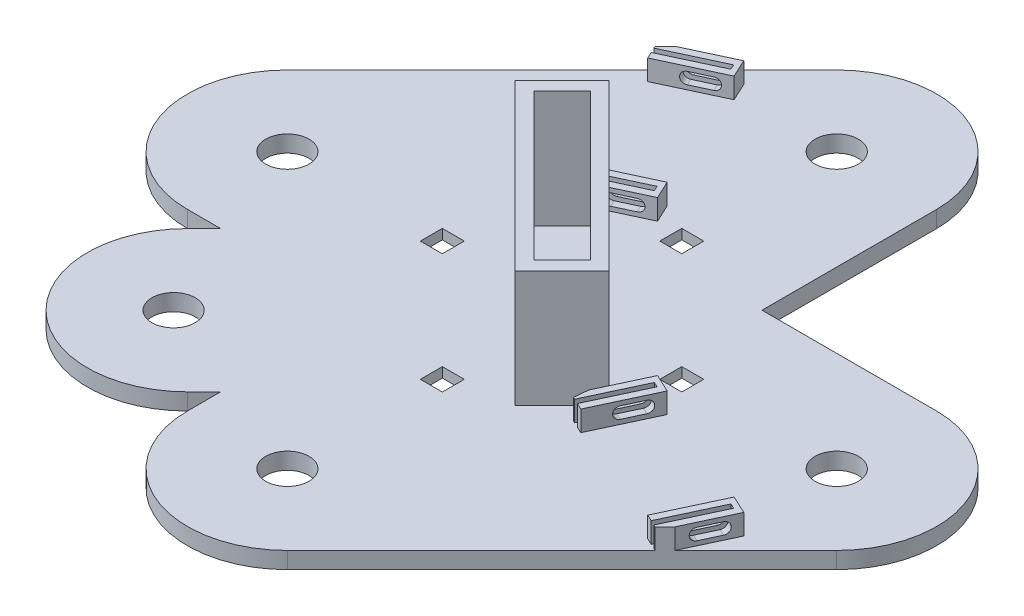
from build123d import *

# Parameters (mm, degrees)
BOSS_EXTRU_1_DEPTH           = 5
ESQUISSE2_R                  = 6.5
ENL_V_MAT_EXTRU_1_DEPTH      = 160.073548788
ENL_V_MAT_EXTRU_2_DEPTH      = 2
ESQUISSE4_R                  = 3.25
ENL_V_MAT_EXTRU_3_DEPTH      = 160.073548788
ESQUISSE5_W                  = 6.6
ESQUISSE5_H                  = 6.6
ENL_V_MAT_EXTRU_4_DEPTH      = 160.073548788
R_P_TITION_CIRCULAIRE1_COUNT = 4
BOSS_EXTRU_2_DEPTH           = 35
ESQUISSE7_R                  = 3.25
ENL_V_MAT_EXTRU_5_DEPTH      = 174.664310989
ENL_V_MAT_EXTRU_6_REACH      = 175.664
ESQUISSE8_W                  = 6.6
ESQUISSE8_H                  = 6.6
ENL_V_MAT_EXTRU_7_DEPTH      = 174.664310989
BOSS_EXTRU_3_DEPTH           = 6.144
ENL_V_MAT_EXTRU_8_REACH      = 251.864


# Read off the part's stored shape, not the designer's step: Symétrie2
with BuildPart() as part:
    # Esquisse1 → Boss.-Extru.1 (new body)
    with BuildSketch(Plane(origin=(0, 0, 0), x_dir=(1, 0, 0), z_dir=(0, 1, 0))):
        with BuildLine():
            Line((-35, -77.426406871), (-30, -72.426406871))
            Line((-30, -72.426406871), (-30, -30))
            Line((-30, -30), (-72.426406871, -30))
            Line((-72.426406871, -30), (-77.426406871, -35))
            ThreePointArc((-77.426406871, -35), (-77.426406871, -77.426406871), (-35, -77.426406871))
        make_face()
        with BuildLine():
            Line((-82.426406871, -30), (-72.426406871, -30))
            Line((-72.426406871, -30), (-30, 12.426406871))
            Line((-30, 12.426406871), (-30, 30))
            Line((-30, 30), (-82.426406871, 30))
            ThreePointArc((-82.426406871, 30), (-93.906909842, 27.716385975), (-103.639610307, 21.213203436))
            ThreePointArc((-103.639610307, 21.213203436), (-110.142792847, -11.480502971), (-82.426406871, -30))
        make_face()
        with BuildLine():
            ThreePointArc((-30, 82.426406871), (-27.716385975, 93.906909842), (-21.213203436, 103.639610307))
            Line((-21.213203436, 103.639610307), (-103.639610307, 21.213203436))
            ThreePointArc((-103.639610307, 21.213203436), (-93.906909842, 27.716385975), (-82.426406871, 30))
            Line((-82.426406871, 30), (-30, 30))
            Line((-30, 30), (-30, 82.426406871))
        make_face()
        with BuildLine():
            ThreePointArc((-1.213203436, 29.975458919), (0, 30), (1.213203436, 29.975458919))
            ThreePointArc((1.213203436, 29.975458919), (1.81968106, 29.993864102), (2.426406871, 30))
            Line((2.426406871, 30), (30, 30))
            Line((30, 30), (30, 82.426406871))
            ThreePointArc((30, 82.426406871), (11.480502971, 110.142792847), (-21.213203436, 103.639610307))
            ThreePointArc((-21.213203436, 103.639610307), (-27.716385975, 93.906909842), (-30, 82.426406871))
            Line((-30, 82.426406871), (-30, 30))
            Line((-30, 30), (-2.426406871, 30))
            ThreePointArc((-2.426406871, 30), (-1.81968106, 29.993864102), (-1.213203436, 29.975458919))
        make_face()
        with BuildLine():
            ThreePointArc((-21.213203436, 21.213203436), (-12.038696424, 27.478533229), (-1.213203436, 29.975458919))
            ThreePointArc((-1.213203436, 29.975458919), (-1.81968106, 29.993864102), (-2.426406871, 30))
            Line((-2.426406871, 30), (-30, 30))
            Line((-30, 30), (-30, 12.426406871))
            Line((-30, 12.426406871), (-21.213203436, 21.213203436))
        make_face()
        with BuildLine():
            ThreePointArc((-29.901714829, 0), (-26.857631607, 10.94025406), (-19.965279452, 19.965279452))
            ThreePointArc((-19.965279452, 19.965279452), (-10.94025406, 26.857631607), (0, 29.901714829))
            ThreePointArc((0, 29.901714829), (-0.606228214, 29.944731584), (-1.213203436, 29.975458919))
            ThreePointArc((-1.213203436, 29.975458919), (-12.038696424, 27.478533229), (-21.213203436, 21.213203436))
            Line((-21.213203436, 21.213203436), (-30, 12.426406871))
            Line((-30, 12.426406871), (-30, 2.426406871))
            ThreePointArc((-30, 2.426406871), (-29.975418636, 1.212208547), (-29.901714829, 0))
        make_face()
        with BuildLine():
            Line((-72.426406871, -30), (-30, -30))
            Line((-30, -30), (-30, -2.426406871))
            ThreePointArc((-30, -2.426406871), (-29.975418636, -1.212208547), (-29.901714829, 0))
            ThreePointArc((-29.901714829, 0), (-29.975418636, 1.212208547), (-30, 2.426406871))
            Line((-30, 2.426406871), (-30, 12.426406871))
            Line((-30, 12.426406871), (-72.426406871, -30))
        make_face()
        with BuildLine():
            ThreePointArc((-2.426406871, -30), (-1.212208547, -29.975418636), (0, -29.901714829))
            ThreePointArc((0, -29.901714829), (-10.94025406, -26.857631607), (-19.965279452, -19.965279452))
            ThreePointArc((-19.965279452, -19.965279452), (-26.857631607, -10.94025406), (-29.901714829, 0))
            ThreePointArc((-29.901714829, 0), (-29.975418636, -1.212208547), (-30, -2.426406871))
            Line((-30, -2.426406871), (-30, -30))
            Line((-30, -30), (-2.426406871, -30))
        make_face()
        with BuildLine():
            Line((-30, -72.426406871), (12.426406871, -30))
            Line((12.426406871, -30), (2.426406871, -30))
            ThreePointArc((2.426406871, -30), (1.212208547, -29.975418636), (0, -29.901714829))
            ThreePointArc((0, -29.901714829), (-1.212208547, -29.975418636), (-2.426406871, -30))
            Line((-2.426406871, -30), (-30, -30))
            Line((-30, -30), (-30, -72.426406871))
        make_face()
        with BuildLine():
            ThreePointArc((21.213203436, -21.213203436), (27.478533229, -12.038696424), (29.975458919, -1.213203436))
            ThreePointArc((29.975458919, -1.213203436), (29.944731584, -0.606228214), (29.901714829, 0))
            ThreePointArc((29.901714829, 0), (26.857631607, -10.94025406), (19.965279452, -19.965279452))
            ThreePointArc((19.965279452, -19.965279452), (10.94025406, -26.857631607), (0, -29.901714829))
            ThreePointArc((0, -29.901714829), (1.212208547, -29.975418636), (2.426406871, -30))
            Line((2.426406871, -30), (12.426406871, -30))
            Line((12.426406871, -30), (21.213203436, -21.213203436))
        make_face()
        with BuildLine():
            Line((30, -30), (30, -2.426406871))
            ThreePointArc((30, -2.426406871), (29.993864102, -1.81968106), (29.975458919, -1.213203436))
            ThreePointArc((29.975458919, -1.213203436), (27.478533229, -12.038696424), (21.213203436, -21.213203436))
            Line((21.213203436, -21.213203436), (12.426406871, -30))
            Line((12.426406871, -30), (30, -30))
        make_face()
        with BuildLine():
            ThreePointArc((1.213203436, 29.975458919), (21.213203436, 21.213203436), (29.975458919, 1.213203436))
            ThreePointArc((29.975458919, 1.213203436), (29.993864102, 1.81968106), (30, 2.426406871))
            Line((30, 2.426406871), (30, 30))
            Line((30, 30), (2.426406871, 30))
            ThreePointArc((2.426406871, 30), (1.81968106, 29.993864102), (1.213203436, 29.975458919))
        make_face()
        with BuildLine():
            ThreePointArc((-19.965279452, 19.965279452), (0, 27.573593129), (19.965279452, 19.965279452))
            ThreePointArc((19.965279452, 19.965279452), (10.94025406, 26.857631607), (0, 29.901714829))
            ThreePointArc((0, 29.901714829), (-10.94025406, 26.857631607), (-19.965279452, 19.965279452))
        make_face()
        with BuildLine():
            ThreePointArc((-19.965279452, -19.965279452), (-27.573593129, 0), (-19.965279452, 19.965279452))
            ThreePointArc((-19.965279452, 19.965279452), (-26.857631607, 10.94025406), (-29.901714829, 0))
            ThreePointArc((-29.901714829, 0), (-26.857631607, -10.94025406), (-19.965279452, -19.965279452))
        make_face()
        with BuildLine():
            ThreePointArc((0, -29.901714829), (10.94025406, -26.857631607), (19.965279452, -19.965279452))
            ThreePointArc((19.965279452, -19.965279452), (0, -27.573593129), (-19.965279452, -19.965279452))
            ThreePointArc((-19.965279452, -19.965279452), (-10.94025406, -26.857631607), (0, -29.901714829))
        make_face()
        with BuildLine():
            Line((30, -82.426406871), (30, -30))
            Line((30, -30), (12.426406871, -30))
            Line((12.426406871, -30), (-30, -72.426406871))
            Line((-30, -72.426406871), (-30, -82.426406871))
            ThreePointArc((-30, -82.426406871), (-11.480502971, -110.142792847), (21.213203436, -103.639610307))
            ThreePointArc((21.213203436, -103.639610307), (27.716385975, -93.906909842), (30, -82.426406871))
        make_face()
        with BuildLine():
            ThreePointArc((29.975458919, -1.213203436), (29.993864102, -1.81968106), (30, -2.426406871))
            Line((30, -2.426406871), (30, -30))
            Line((30, -30), (82.426406871, -30))
            ThreePointArc((82.426406871, -30), (93.906909842, -27.716385975), (103.639610307, -21.213203436))
            ThreePointArc((103.639610307, -21.213203436), (110.142792847, 11.480502971), (82.426406871, 30))
            Line((82.426406871, 30), (30, 30))
            Line((30, 30), (30, 2.426406871))
            ThreePointArc((30, 2.426406871), (29.993864102, 1.81968106), (29.975458919, 1.213203436))
            ThreePointArc((29.975458919, 1.213203436), (30, 0), (29.975458919, -1.213203436))
        make_face()
        with BuildLine():
            Line((82.426406871, -30), (30, -30))
            Line((30, -30), (30, -82.426406871))
            ThreePointArc((30, -82.426406871), (27.716385975, -93.906909842), (21.213203436, -103.639610307))
            Line((21.213203436, -103.639610307), (103.639610307, -21.213203436))
            ThreePointArc((103.639610307, -21.213203436), (93.906909842, -27.716385975), (82.426406871, -30))
        make_face()
        with BuildLine():
            ThreePointArc((19.965279452, -19.965279452), (27.573593129, 0), (19.965279452, 19.965279452))
            ThreePointArc((19.965279452, 19.965279452), (0, 27.573593129), (-19.965279452, 19.965279452))
            ThreePointArc((-19.965279452, 19.965279452), (-27.573593129, 0), (-19.965279452, -19.965279452))
            ThreePointArc((-19.965279452, -19.965279452), (0, -27.573593129), (19.965279452, -19.965279452))
        make_face()
        with BuildLine():
            ThreePointArc((19.965279452, -19.965279452), (26.857631607, -10.94025406), (29.901714829, 0))
            ThreePointArc((29.901714829, 0), (26.857631607, 10.94025406), (19.965279452, 19.965279452))
            ThreePointArc((19.965279452, 19.965279452), (27.573593129, 0), (19.965279452, -19.965279452))
        make_face()
        with BuildLine():
            ThreePointArc((19.965279452, 19.965279452), (26.857631607, 10.94025406), (29.901714829, 0))
            ThreePointArc((29.901714829, 0), (29.944731584, 0.606228214), (29.975458919, 1.213203436))
            ThreePointArc((29.975458919, 1.213203436), (21.213203436, 21.213203436), (1.213203436, 29.975458919))
            ThreePointArc((1.213203436, 29.975458919), (0.606228214, 29.944731584), (0, 29.901714829))
            ThreePointArc((0, 29.901714829), (10.94025406, 26.857631607), (19.965279452, 19.965279452))
        make_face()
        with BuildLine():
            ThreePointArc((0, 29.901714829), (0.606228214, 29.944731584), (1.213203436, 29.975458919))
            ThreePointArc((1.213203436, 29.975458919), (0, 30), (-1.213203436, 29.975458919))
            ThreePointArc((-1.213203436, 29.975458919), (-0.606228214, 29.944731584), (0, 29.901714829))
        make_face()
        with BuildLine():
            ThreePointArc((29.901714829, 0), (29.944731584, -0.606228214), (29.975458919, -1.213203436))
            ThreePointArc((29.975458919, -1.213203436), (30, 0), (29.975458919, 1.213203436))
            ThreePointArc((29.975458919, 1.213203436), (29.944731584, 0.606228214), (29.901714829, 0))
        make_face()
    extrude(amount=BOSS_EXTRU_1_DEPTH)

    # Esquisse2 → Enlèv. mat.-Extru.1 (cut, through all)
    with BuildSketch(Plane.XZ):
        with Locations(Location((82.426406871, 0, 0), (0, 0, 270))):
            Circle(ESQUISSE2_R)
        with Locations(Location((0, -82.426406871, 0), (0, 0, 270))):
            Circle(ESQUISSE2_R)
        with Locations(Location((-82.426406871, 0, 0), (0, 0, 270))):
            Circle(ESQUISSE2_R)
        with Locations(Location((-58.284271247, 58.284271247, 0), (0, 0, 270))):
            Circle(ESQUISSE2_R)
        with Locations(Location((0, 82.426406871, 0), (0, 0, 270))):
            Circle(ESQUISSE2_R)
    extrude(amount=-ENL_V_MAT_EXTRU_1_DEPTH, mode=Mode.SUBTRACT)

    # Esquisse3 → Enlèv. mat.-Extru.2 (cut)
    with BuildSketch(Plane.XZ):
        with BuildLine():
            Line((50.80363027, 15), (25.80363027, 15))
            Line((25.80363027, 15), (25.80363027, -15))
            Line((25.80363027, -15), (50.80363027, -15))
            ThreePointArc((50.80363027, -15), (47.426406871, 0), (50.80363027, 15))
        make_face()
        with BuildLine():
            Line((-15, -25.80363027), (-15, -50.80363027))
            ThreePointArc((-15, -50.80363027), (0, -47.426406871), (15, -50.80363027))
            Line((15, -50.80363027), (15, -25.80363027))
            Line((15, -25.80363027), (-15, -25.80363027))
        make_face()
        with BuildLine():
            Line((-25.80363027, 15), (-50.80363027, 15))
            ThreePointArc((-50.80363027, 15), (-47.426406871, 0), (-50.80363027, -15))
            Line((-50.80363027, -15), (-25.80363027, -15))
            Line((-25.80363027, -15), (-25.80363027, 15))
        make_face()
        with BuildLine():
            Line((15, 25.80363027), (15, 50.80363027))
            ThreePointArc((15, 50.80363027), (0, 47.426406871), (-15, 50.80363027))
            Line((-15, 50.80363027), (-15, 25.80363027))
            Line((-15, 25.80363027), (15, 25.80363027))
        make_face()
    extrude(amount=-ENL_V_MAT_EXTRU_2_DEPTH, mode=Mode.SUBTRACT)

    # Esquisse4 → Enlèv. mat.-Extru.3 (cut, through all)
    with BuildSketch(Plane(origin=(0, 5, 0), x_dir=(1, 0, 0), z_dir=(0, 1, 0))):
        with Locations(Location((35.926406871, 0, 0), (0, 0, 270))):
            Circle(ESQUISSE4_R)
    extrude(amount=-ENL_V_MAT_EXTRU_3_DEPTH, mode=Mode.SUBTRACT)

    # Esquisse5 → Enlèv. mat.-Extru.4 (cut, through all)
    with BuildSketch(Plane(origin=(0, 5, 0), x_dir=(1, 0, 0), z_dir=(0, 1, 0))):
        with Locations((35.926406871, 0)):
            Rectangle(ESQUISSE5_W, ESQUISSE5_H)
    enl_v_mat_extru_4 = extrude(amount=-ENL_V_MAT_EXTRU_4_DEPTH, mode=Mode.SUBTRACT)

    # Répétition circulaire1: Enlèv. mat.-Extru.4 ×4 about axis
    r_p_tition_circulaire1_axis = Axis((0, 0, 0), (0, 1, 0))
    for i in range(1, R_P_TITION_CIRCULAIRE1_COUNT):
        add(enl_v_mat_extru_4.rotate(r_p_tition_circulaire1_axis, i * 360 / R_P_TITION_CIRCULAIRE1_COUNT), mode=Mode.SUBTRACT)

    # Esquisse6 → Boss.-Extru.2 (add)
    with BuildSketch(Plane(origin=(0, 5, 0), x_dir=(1, 0, 0), z_dir=(0, 1, 0))):
        Polygon((31.819805153, -17.67766953), (-17.67766953, 31.819805153), (-31.819805153, 17.67766953), (17.67766953, -31.819805153), align=None)
        Polygon((17.67766953, -26.162950904), (26.162950904, -17.67766953), (-17.67766953, 26.162950904), (-26.162950904, 17.67766953), align=None, mode=Mode.SUBTRACT)
    extrude(amount=BOSS_EXTRU_2_DEPTH)

    # Esquisse7 → Enlèv. mat.-Extru.5 (cut, through all)
    with BuildSketch(Plane(origin=(7.071067812, 0, -7.071067812), x_dir=(-0.7071067811865506, 0, -0.7071067811865446), z_dir=(0.7071067811865446, 0, -0.7071067811865506))):
        with Locations((0, 28)):
            Circle(ESQUISSE7_R)
    extrude(amount=-ENL_V_MAT_EXTRU_5_DEPTH, mode=Mode.SUBTRACT)

    # Esquisse8 → Enlèv. mat.-Extru.6 (cut, up to next)
    with BuildSketch(Plane(origin=(7.071067812, 0, -7.071067812), x_dir=(-0.7071067811865506, 0, -0.7071067811865446), z_dir=(0.7071067811865446, 0, -0.7071067811865506)), mode=Mode.PRIVATE) as enl_v_mat_extru_6_sk1:
        with Locations((0, 28)):
            Rectangle(ESQUISSE8_W, ESQUISSE8_H)
    enl_v_mat_extru_6_tool1 = extrude(enl_v_mat_extru_6_sk1.sketch, amount=-ENL_V_MAT_EXTRU_6_REACH, mode=Mode.PRIVATE) & part.part
    add(enl_v_mat_extru_6_tool1.solids().sort_by_distance((7.071068, 28, -7.071068))[0], mode=Mode.SUBTRACT)

    # Esquisse9 → Enlèv. mat.-Extru.7 (cut, through all)
    with BuildSketch(Plane(origin=(7.071067812, 0, -7.071067812), x_dir=(-0.7071067811865506, 0, -0.7071067811865446), z_dir=(0.7071067811865446, 0, -0.7071067811865506))):
        Polygon((-10, 10), (10, 10), (0, 20), align=None)
    extrude(amount=-ENL_V_MAT_EXTRU_7_DEPTH, mode=Mode.SUBTRACT)

    # Esquisse11 → Boss.-Extru.3 (add)
    with BuildSketch(Plane(origin=(0, 5, 0), x_dir=(1, 0, 0), z_dir=(0, 1, 0))):
        Polygon((83.359135653, -31.86483373), (85.307697395, -32.773462993), (85.941624788, -31.414001312), (80.503778066, -28.878291742), (79.869850673, -30.237753423), (81.818412415, -31.146382685), align=None)
        Polygon((72.262721962, -46.551293589), (79.869850673, -30.237753423), (81.818412415, -31.146382685), (74.211283704, -47.459922852), align=None)
        Polygon((79.391041731, -45.461772011), (85.307697395, -32.773462993), (83.359135653, -31.86483373), (75.752006942, -48.178373897), (76.381092454, -48.471721289), align=None)
    boss_extru_3 = extrude(amount=BOSS_EXTRU_3_DEPTH)

    # Symétrie1: Boss.-Extru.3 across plane
    add(boss_extru_3.mirror(Plane(origin=(58.380445446, 0, 27.223248798), x_dir=(-0.42261826174069733, 0, 0.906307787036651), z_dir=(-0.906307787036651, 0, -0.4226182617406973))))

    # Enlèv. mat.-Extru.8: up to this face of the body (flat: up to its plane)
    enl_v_mat_extru_8_end = Plane(part.part.faces().sort_by_distance((34.178866653, 8.072, 15.827809659))[0])
    # Esquisse12 → Enlèv. mat.-Extru.8 (cut, up to the picked face)
    with BuildSketch(Plane(origin=(82.62417875, 0, 38.5282873), x_dir=(0.4226182617406896, 0, -0.9063077870366546), z_dir=(0.9063077870366545, 0, 0.42261826174068956)), mode=Mode.PRIVATE) as enl_v_mat_extru_8_sk1:
        with BuildLine():
            Line((-2.722253932, 9.822), (3.277746068, 9.822))
            ThreePointArc((3.277746068, 9.822), (5.027746068, 8.072), (3.277746068, 6.322))
            Line((3.277746068, 6.322), (-2.722253932, 6.322))
            ThreePointArc((-2.722253932, 6.322), (-4.472253932, 8.072), (-2.722253932, 9.822))
        make_face()
    enl_v_mat_extru_8_tool1 = split(extrude(enl_v_mat_extru_8_sk1.sketch, amount=-ENL_V_MAT_EXTRU_8_REACH, mode=Mode.PRIVATE), bisect_by=enl_v_mat_extru_8_end, keep=Keep.BOTH, mode=Mode.PRIVATE)
    add(enl_v_mat_extru_8_tool1.solids().sort_by(Axis((82.741559, 8.072, 38.276564), (-0.9063077870366545, 0, -0.42261826174068956)))[0], mode=Mode.SUBTRACT)

    # Symétrie2: part across plane


with BuildPart() as part_1:
    add(part.part)
    add(part.part.mirror(Plane(origin=(0, 0, 0), x_dir=(-0.7071067811865478, 0, 0.7071067811865472), z_dir=(0.7071067811865475, 0, 0.7071067811865477))))


solid = part_1.part
